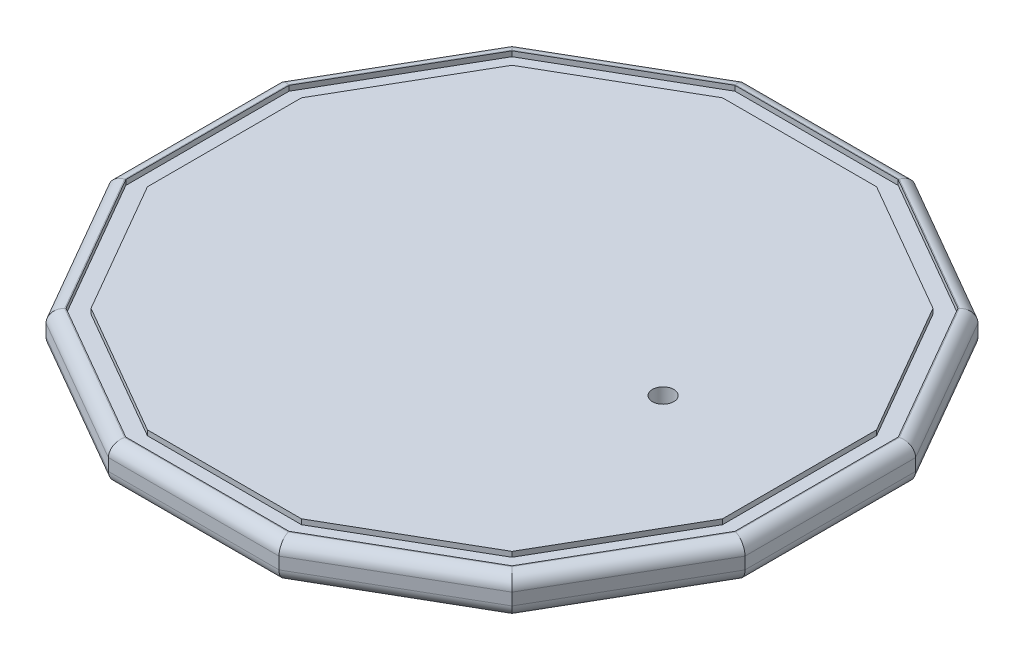
from build123d import *

# Parameters (mm, degrees)
EXTRUDE_1_DEPTH          = 4.4
CUT_EXTRUDE_1_DEPTH      = 0.6
FILLET_1_R               = 1.5
SKETCH_3_W               = 5
SKETCH_3_H               = 9
EXTRUDE_2_DEPTH          = 14.5
FILLET_2_R               = 4.5
CUT_EXTRUDE_2_DEPTH      = 57.417976641
CUT_EXTRUDE_2_DEPTH_BACK = 57.417976641
SKETCH_4_R               = 1.55
CUT_EXTRUDE_3_DEPTH      = 55.68383811
CUT_EXTRUDE_3_DEPTH_BACK = 55.68383811
SKETCH_5_R               = 1.25


with BuildPart() as part:
    # 스케치1 → 보스-돌출1 (new body)
    with BuildSketch(Plane(origin=(0, 0, 0), x_dir=(1, 0, 0), z_dir=(0, 1, 0))):
        Polygon((27.293187568, -27.293187568), (37.283187568, -9.99), (37.283187568, 9.99), (27.293187568, 27.293187568), (9.99, 37.283187568), (-9.99, 37.283187568), (-27.293187568, 27.293187568), (-37.283187568, 9.99), (-37.283187568, -9.99), (-27.293187568, -27.293187568), (-9.99, -37.283187568), (9.99, -37.283187568), align=None)
    extrude(amount=EXTRUDE_1_DEPTH)

    # 스케치2 → 컷-돌출1 (cut)
    with BuildSketch(Plane(origin=(0, 4.4, 0), x_dir=(1, 0, 0), z_dir=(0, 1, 0))):
        Polygon((-26.120860153, 26.120860153), (-35.681758538, 9.560898385), (-35.681758538, -9.560898385), (-26.120860153, -26.120860153), (-9.560898385, -35.681758538), (9.560898385, -35.681758538), (26.120860153, -26.120860153), (35.681758538, -9.560898385), (35.681758538, 9.560898385), (26.120860153, 26.120860153), (9.560898385, 35.681758538), (-9.560898385, 35.681758538), align=None)
        Polygon((24.656758538, -24.656758538), (33.681758538, -9.025), (33.681758538, 9.025), (24.656758538, 24.656758538), (9.025, 33.681758538), (-9.025, 33.681758538), (-24.656758538, 24.656758538), (-33.681758538, 9.025), (-33.681758538, -9.025), (-24.656758538, -24.656758538), (-9.025, -33.681758538), (9.025, -33.681758538), align=None, mode=Mode.SUBTRACT)
    extrude(amount=-CUT_EXTRUDE_1_DEPTH, mode=Mode.SUBTRACT)

    # 필렛1
    fillet_1_edges = [part.edges().sort_by_distance(p)[0] for p in [
        (0, 0, 37.283187568),
        (-18.641593784, 0, 32.288187568),
        (37.283187568, 4.4, 0),
        (-32.288187568, 0, 18.641593784),
        (-37.283187568, 0, 0),
        (-32.288187568, 0, -18.641593784),
        (-18.641593784, 0, -32.288187568),
        (0, 0, -37.283187568),
        (18.641593784, 0, -32.288187568),
        (32.288187568, 0, -18.641593784),
        (37.283187568, 0, 0),
        (32.288187568, 0, 18.641593784),
        (18.641593784, 0, 32.288187568),
        (32.288187568, 4.4, -18.641593784),
        (18.641593784, 4.4, -32.288187568),
        (0, 4.4, -37.283187568),
        (-18.641593784, 4.4, -32.288187568),
        (-32.288187568, 4.4, -18.641593784),
        (-37.283187568, 4.4, 0),
        (-32.288187568, 4.4, 18.641593784),
        (-18.641593784, 4.4, 32.288187568),
        (0, 4.4, 37.283187568),
        (18.641593784, 4.4, 32.288187568),
        (32.288187568, 4.4, 18.641593784),
    ]]
    fillet(fillet_1_edges, radius=FILLET_1_R)

    # 스케치3 → 보스-돌출2 (add)
    with BuildSketch(Plane.XZ):
        with Locations((0, -15)):
            Rectangle(SKETCH_3_W, SKETCH_3_H)
        with Locations((0, 15)):
            Rectangle(SKETCH_3_W, SKETCH_3_H)
    extrude(amount=EXTRUDE_2_DEPTH)

    # 필렛2
    fillet_2_edges = [part.edges().sort_by_distance(p)[0] for p in [
        (0, -14.5, -19.5),
        (0, -14.5, -10.5),
        (0, -14.5, 19.5),
        (0, -14.5, 10.5),
    ]]
    fillet(fillet_2_edges, radius=FILLET_2_R - 0.0001)  # a hair under: the kernel refuses the full size

    # 스케치4 → 컷-돌출2 (cut, two sides: drawn at the far end of the back side and taken through both)
    with BuildSketch(Plane.ZY.offset(2.5).offset(-CUT_EXTRUDE_2_DEPTH_BACK)):
        with Locations((-15, -10)):
            Circle(SKETCH_4_R)
        with Locations((15, -10)):
            Circle(SKETCH_4_R)
    extrude(amount=CUT_EXTRUDE_2_DEPTH + CUT_EXTRUDE_2_DEPTH_BACK, mode=Mode.SUBTRACT)

    # 스케치5 → 컷-돌출3 (cut, two sides: drawn at the far end of the back side and taken through both)
    with BuildSketch(Plane.XZ.offset(-CUT_EXTRUDE_3_DEPTH_BACK)):
        with Locations(Location((17.7, 0, 0), (0, 0, 270))):
            Circle(SKETCH_5_R)
    extrude(amount=CUT_EXTRUDE_3_DEPTH + CUT_EXTRUDE_3_DEPTH_BACK, mode=Mode.SUBTRACT)


solid = part.part
